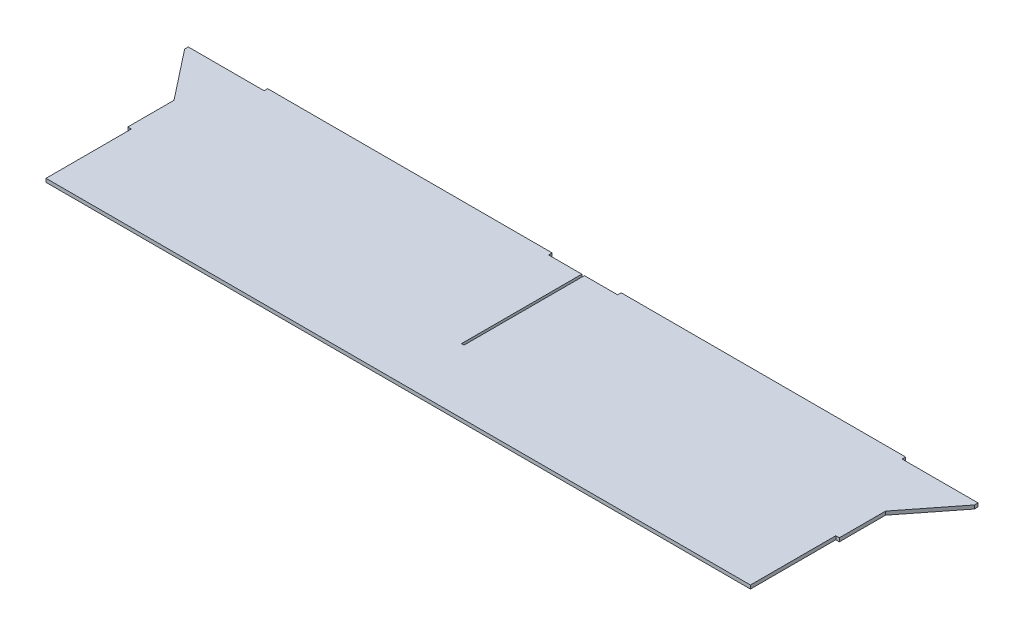
from build123d import *

# Parameters (mm, degrees)
SKETCH1_W           = 635.3556
SKETCH1_H           = 165.1
BOSS_EXTRUDE1_DEPTH = 1.5875
SKETCH2_W           = 254
SKETCH2_H           = 3.175
BOSS_EXTRUDE2_DEPTH = 3.175
BOSS_EXTRUDE3_DEPTH = 3.175
SKETCH5_W           = 3.175
SKETCH5_H           = 76.2
SKETCH5_W_2         = 2.286
SKETCH5_H_2         = 107.442
CUT_EXTRUDE2_DEPTH  = 363.887848815


with BuildPart() as part:
    # Sketch1 → Boss-Extrude1 (new, symmetric)
    with BuildSketch(Plane(origin=(0, 0, 0), x_dir=(1, 0, 0), z_dir=(0, 1, 0))):
        Rectangle(SKETCH1_W, SKETCH1_H)
    extrude(amount=BOSS_EXTRUDE1_DEPTH, both=True)

    # Sketch2 → Boss-Extrude2 (add)
    with BuildSketch(Plane(origin=(0, 0, -82.55), x_dir=(-1, 0, 0), z_dir=(0, 0, -1))):
        with Locations((-157.8229, 0)):
            Rectangle(SKETCH2_W, SKETCH2_H)
        with Locations((157.8229, 0)):
            Rectangle(SKETCH2_W, SKETCH2_H)
    extrude(amount=BOSS_EXTRUDE2_DEPTH)

    # Sketch3 → Boss-Extrude3 (add)
    with BuildSketch(Plane.XZ.offset(1.5875)):
        Polygon((317.6778, -82.55), (352.6028, -82.55), (352.6028, -79.375), (317.6778, -34.925), align=None)
    boss_extrude3 = extrude(amount=-BOSS_EXTRUDE3_DEPTH)

    # Mirror1: Boss-Extrude3 across plane
    add(boss_extrude3.mirror(Plane(origin=(0, 0, 0), x_dir=(0, 0, 1), z_dir=(1, 0, 0))))

    # Sketch5 → Cut-Extrude2 (cut, through all)
    with BuildSketch(Plane.XZ.offset(1.5875)):
        with Locations((316.0903, 44.45)):
            Rectangle(SKETCH5_W, SKETCH5_H)
        with Locations((0, -28.829)):
            Rectangle(SKETCH5_W_2, SKETCH5_H_2)
        with Locations((-316.0903, 44.45)):
            Rectangle(SKETCH5_W, SKETCH5_H)
    extrude(amount=-CUT_EXTRUDE2_DEPTH, mode=Mode.SUBTRACT)


solid = part.part
